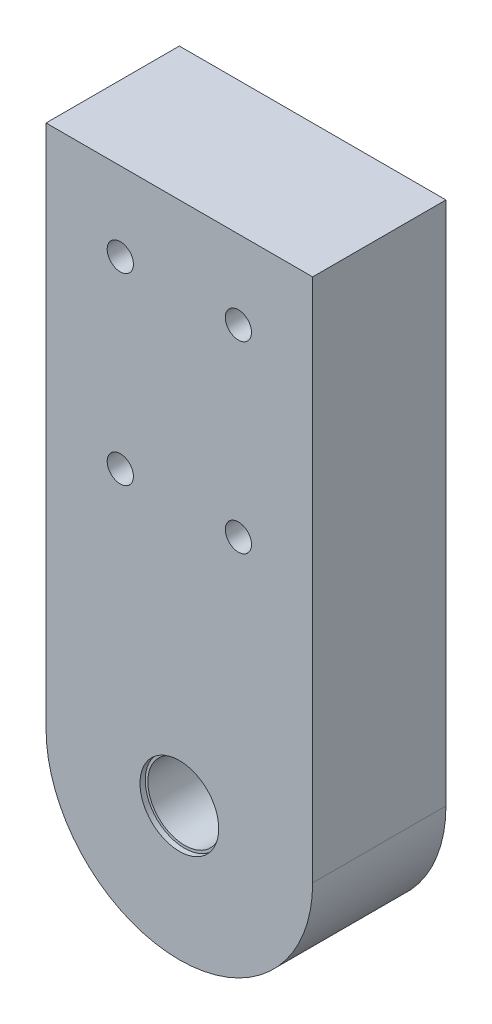
from build123d import *

# Parameters (mm, degrees)
SKETCH1_R           = 7
SKETCH1_R_2         = 2.5
BOSS_EXTRUDE1_DEPTH = 25.4
SKETCH2_R           = 7.5
CUT_EXTRUDE1_DEPTH  = 1
CUT_EXTRUDE2_START  = -1
SKETCH3_R           = 7.5
CUT_EXTRUDE2_DEPTH  = 1


with BuildPart() as part:
    # Sketch1 → Boss-Extrude1 (new body)
    with BuildSketch(Plane.XY):
        with BuildLine():
            Line((-25.4, 0), (-25.4, 100))
            Line((-25.4, 100), (25.4, 100))
            Line((25.4, 100), (25.4, 0))
            ThreePointArc((25.4, 0), (0, -25.4), (-25.4, 0))
        make_face()
        Circle(SKETCH1_R, mode=Mode.SUBTRACT)
        with Locations((-11.25, 85)):
            Circle(SKETCH1_R_2, mode=Mode.SUBTRACT)
        with Locations((11.25, 85)):
            Circle(SKETCH1_R_2, mode=Mode.SUBTRACT)
        with Locations((11.25, 50)):
            Circle(SKETCH1_R_2, mode=Mode.SUBTRACT)
        with Locations((-11.25, 50)):
            Circle(SKETCH1_R_2, mode=Mode.SUBTRACT)
    extrude(amount=BOSS_EXTRUDE1_DEPTH)

    # Sketch2 → Cut-Extrude1 (cut)
    with BuildSketch(Plane.XY.offset(25.4)):
        Circle(SKETCH2_R)
    extrude(amount=-CUT_EXTRUDE1_DEPTH, mode=Mode.SUBTRACT)

    # Sketch3 → Cut-Extrude2 (cut)
    with BuildSketch(Plane(origin=(0, 0, 0), x_dir=(-1, 0, 0), z_dir=(0, 0, -1)).offset(CUT_EXTRUDE2_START)):
        Circle(SKETCH3_R)
    extrude(amount=CUT_EXTRUDE2_DEPTH, mode=Mode.SUBTRACT)


solid = part.part
